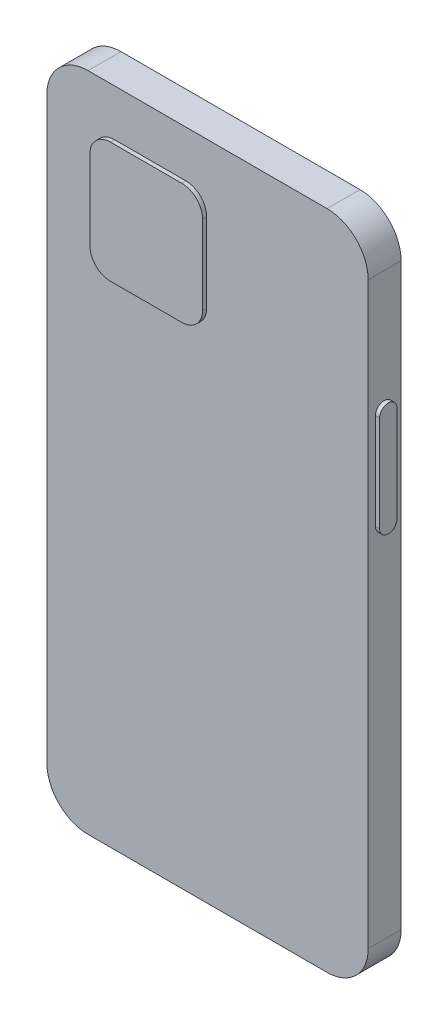
from build123d import *

# Parameters (mm, degrees)
EXTRUDE_1_DEPTH  = 8
EXTRUDE_2_DEPTH  = 1
EXTRUDE_4_DEPTH  = 1
EXTRUDE_13_DEPTH = 1


with BuildPart() as part:
    # 草图1 → 凸台-拉伸1 (new body)
    with BuildSketch(Plane.XY):
        with BuildLine():
            Line((-29.05, 80.4), (29.05, 80.4))
            ThreePointArc((29.05, 80.4), (36.121067812, 77.471067812), (39.05, 70.4))
            Line((39.05, 70.4), (39.05, -70.4))
            ThreePointArc((39.05, -70.4), (36.121067812, -77.471067812), (29.05, -80.4))
            Line((29.05, -80.4), (-29.05, -80.4))
            ThreePointArc((-29.05, -80.4), (-36.121067812, -77.471067812), (-39.05, -70.4))
            Line((-39.05, -70.4), (-39.05, 70.4))
            ThreePointArc((-39.05, 70.4), (-36.121067812, 77.471067812), (-29.05, 80.4))
        make_face()
    extrude(amount=EXTRUDE_1_DEPTH)

    # 草图3 → 凸台-拉伸2 (add)
    with BuildSketch(Plane(origin=(39.05, 0, 0), x_dir=(0, 0, -1), z_dir=(1, 0, 0))):
        with BuildLine():
            Line((-2.010301012, 40.938055265), (-2.010301012, 17.567839325))
            ThreePointArc((-2.010301012, 17.567839325), (-4.115725872, 15.462414466), (-6.221150731, 17.567839325))
            Line((-6.221150731, 17.567839325), (-6.221150731, 40.938055265))
            ThreePointArc((-6.221150731, 40.938055265), (-4.115725872, 43.043480124), (-2.010301012, 40.938055265))
        make_face()
    extrude(amount=EXTRUDE_2_DEPTH)

    # 草图4 → 凸台-拉伸4 (add)
    with BuildSketch(Plane.ZY.offset(39.05)):
        with BuildLine():
            Line((4.94779884, 59.288434377), (4.94779884, 51.309430125))
            ThreePointArc((4.94779884, 51.309430125), (3.495479174, 49.857110458), (2.043159507, 51.309430125))
            Line((2.043159507, 51.309430125), (2.043159507, 59.288434377))
            ThreePointArc((2.043159507, 59.288434377), (3.495479174, 60.740754044), (4.94779884, 59.288434377))
        make_face()
        with BuildLine():
            Line((4.94779884, 40.449118781), (4.94779884, 25.377666304))
            ThreePointArc((4.94779884, 25.377666304), (3.495479174, 23.925346637), (2.043159507, 25.377666304))
            Line((2.043159507, 25.377666304), (2.043159507, 40.449118781))
            ThreePointArc((2.043159507, 40.449118781), (3.495479174, 41.901438447), (4.94779884, 40.449118781))
        make_face()
        with BuildLine():
            Line((5.169437847, 21.16652517), (5.169437847, 4.321960637))
            ThreePointArc((5.169437847, 4.321960637), (3.495479174, 2.648001963), (1.8215205, 4.321960637))
            Line((1.8215205, 4.321960637), (1.8215205, 21.16652517))
            ThreePointArc((1.8215205, 21.16652517), (3.495479174, 22.840483844), (5.169437847, 21.16652517))
        make_face()
    extrude(amount=EXTRUDE_4_DEPTH)

    # 草图8 → 凸台-拉伸13 (add)
    with BuildSketch(Plane.XY.offset(8)):
        with BuildLine():
            Line((-22.608039169, 69.074758041), (-5.221639007, 69.074758041))
            ThreePointArc((-5.221639007, 69.074758041), (-1.686105101, 67.610291947), (-0.221639007, 64.074758041))
            Line((-0.221639007, 64.074758041), (-0.221639007, 44.78420176))
            ThreePointArc((-0.221639007, 44.78420176), (-1.686105101, 41.248667854), (-5.221639007, 39.78420176))
            Line((-5.221639007, 39.78420176), (-22.608039169, 39.78420176))
            ThreePointArc((-22.608039169, 39.78420176), (-26.143573075, 41.248667854), (-27.608039169, 44.78420176))
            Line((-27.608039169, 44.78420176), (-27.608039169, 64.074758041))
            ThreePointArc((-27.608039169, 64.074758041), (-26.143573075, 67.610291947), (-22.608039169, 69.074758041))
        make_face()
    extrude(amount=EXTRUDE_13_DEPTH)


solid = part.part
